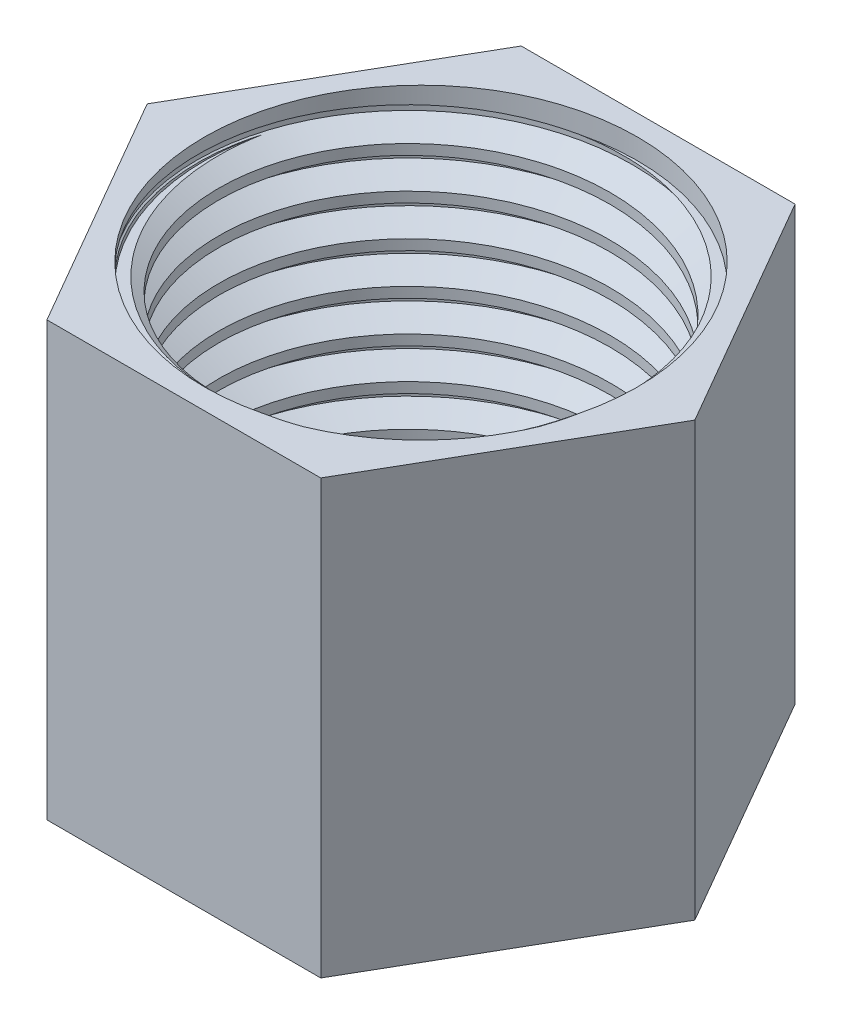
from build123d import *

# Parameters (mm, degrees)
ESQUISSE1_R             = 9.5
BOSS_EXTRU_1_DEPTH      = 21
FILETAGE1_PITCH         = 2
ESQUISSE2_R             = 10.5
ENL_V_MAT_EXTRU_1_DEPTH = 1


with BuildPart() as part:
    # Esquisse1 → Boss.-Extru.1 (new body)
    with BuildSketch(Plane(origin=(0, 0, 0), x_dir=(1, 0, 0), z_dir=(0, 1, 0))):
        Polygon((-6.639528096, -11.5), (6.639528096, -11.5), (13.279056191, 0), (6.639528096, 11.5), (-6.639528096, 11.5), (-13.279056191, 0), align=None)
        with Locations(Location((0, 0, 0), (0, 0, 90))):
            Circle(ESQUISSE1_R, mode=Mode.SUBTRACT)
    extrude(amount=BOSS_EXTRU_1_DEPTH)

    # Filetage1: the profile of Profil de filetage1 profile screwed along a right-hand helix of 11.5 turns, 10 arcs to a turn; built about Z, then put on its axis
    filetage1_z = Axis((0, 0, 0), (0, 0, 1))
    filetage1_corners = [(9.4997, 0, -0.000173205), (10.58253175, 0, 0.624999997), (10.58253175, 0, 0.874999997), (9.4997, 0, 1.5001732)]
    with BuildLine(mode=Mode.PRIVATE) as filetage1_profile:
        Line(filetage1_corners[0], filetage1_corners[1])
        Line(filetage1_corners[1], filetage1_corners[2])
        Line(filetage1_corners[2], filetage1_corners[3])
        Line(filetage1_corners[3], filetage1_corners[0])
    filetage1_cap = Face(filetage1_profile.wire())
    filetage1_turn_angles = [0, 18, 36, 54, 72, 90, 108, 126, 144, 162, 180, 198, 216, 234, 252, 270, 288, 306, 324, 342, 360]
    filetage1_turn_weights = [1, 0.9510565162951535, 1, 0.9510565162951535, 1, 0.9510565162951535, 1, 0.9510565162951535, 1, 0.9510565162951535, 1, 0.9510565162951535, 1, 0.9510565162951535, 1, 0.9510565162951535, 1, 0.9510565162951535, 1, 0.9510565162951535, 1]
    filetage1_turn_rails = [Edge.make_bspline([Vector(p[0], p[1], 0).rotate(filetage1_z, filetage1_turn_angles[k]) / filetage1_turn_weights[k] + Vector(0, 0, p[2] + FILETAGE1_PITCH * filetage1_turn_angles[k] / 360) for k in range(21)], [0, 0, 0, 1, 1, 2, 2, 3, 3, 4, 4, 5, 5, 6, 6, 7, 7, 8, 8, 9, 9, 10, 10, 10], 2, filetage1_turn_weights) for p in filetage1_corners]
    filetage1_turn_sides = [Face.make_surface_from_curves(filetage1_turn_rails[p[0]], filetage1_turn_rails[p[1]]) for p in [(0, 1), (1, 2), (2, 3), (3, 0)]]
    filetage1_last_angles = [3960, 3978, 3996, 4014, 4032, 4050, 4068, 4086, 4104, 4122, 4140]
    filetage1_last_weights = [1, 0.9510565162951535, 1, 0.9510565162951535, 1, 0.9510565162951535, 1, 0.9510565162951535, 1, 0.9510565162951535, 1]
    filetage1_last_rails = [Edge.make_bspline([Vector(p[0], p[1], 0).rotate(filetage1_z, filetage1_last_angles[k]) / filetage1_last_weights[k] + Vector(0, 0, p[2] + FILETAGE1_PITCH * filetage1_last_angles[k] / 360) for k in range(11)], [0, 0, 0, 1, 1, 2, 2, 3, 3, 4, 4, 5, 5, 5], 2, filetage1_last_weights) for p in filetage1_corners]
    filetage1_last_sides = [Face.make_surface_from_curves(filetage1_last_rails[p[0]], filetage1_last_rails[p[1]]) for p in [(0, 1), (1, 2), (2, 3), (3, 0)]]
    filetage1 = Plane(origin=(0, 23, 0), x_dir=(-1, 0, 0), z_dir=(0, -1, 0)) * Solid(Shell([*[p.moved(Location((0, 0, FILETAGE1_PITCH * i))) for i in range(11) for p in filetage1_turn_sides], *filetage1_last_sides, filetage1_cap, filetage1_cap.rotate(filetage1_z, 4140).moved(Location((0, 0, FILETAGE1_PITCH * 4140 / 360)))]))
    add(filetage1, mode=Mode.SUBTRACT)

    # Esquisse2 → Enlèv. mat.-Extru.1 (cut)
    with BuildSketch(Plane(origin=(0, 21, 0), x_dir=(1, 0, 0), z_dir=(0, 1, 0))):
        Circle(ESQUISSE2_R)
    extrude(amount=-ENL_V_MAT_EXTRU_1_DEPTH, mode=Mode.SUBTRACT)


solid = part.part
